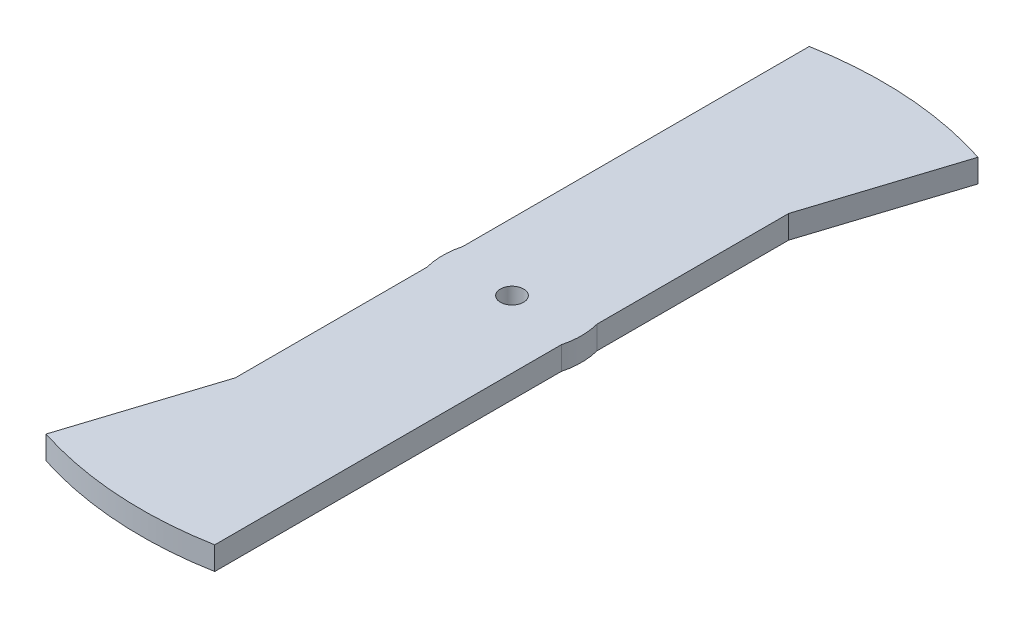
from build123d import *

# Parameters (mm, degrees)
SKETCH1_R           = 3.175
BOSS_EXTRUDE1_DEPTH = 6.35


with BuildPart() as part:
    # Sketch1 → Boss-Extrude1 (new body)
    with BuildSketch(Plane(origin=(0, 0, 0), x_dir=(1, 0, 0), z_dir=(0, 1, 0))):
        with BuildLine():
            ThreePointArc((31.014736842, 96.750432033), (6.495802818, 101.392132563), (-18.415, 99.9172046))
            Line((-18.415, 99.9172046), (-18.415, 4.87752755))
            ThreePointArc((-18.415, 4.87752755), (-19.05, 0), (-18.415, -4.87752755))
            Line((-18.415, -4.87752755), (-18.415, -57.44556902))
            Line((-18.415, -57.44556902), (-31.014736842, -96.750432033))
            ThreePointArc((-31.014736842, -96.750432033), (-6.495802818, -101.392132563), (18.415, -99.9172046))
            Line((18.415, -99.9172046), (18.415, -4.87752755))
            ThreePointArc((18.415, -4.87752755), (19.05, 0), (18.415, 4.87752755))
            Line((18.415, 4.87752755), (18.415, 57.44556902))
            Line((18.415, 57.44556902), (31.014736842, 96.750432033))
        make_face()
        Circle(SKETCH1_R, mode=Mode.SUBTRACT)
    extrude(amount=BOSS_EXTRUDE1_DEPTH)


solid = part.part
